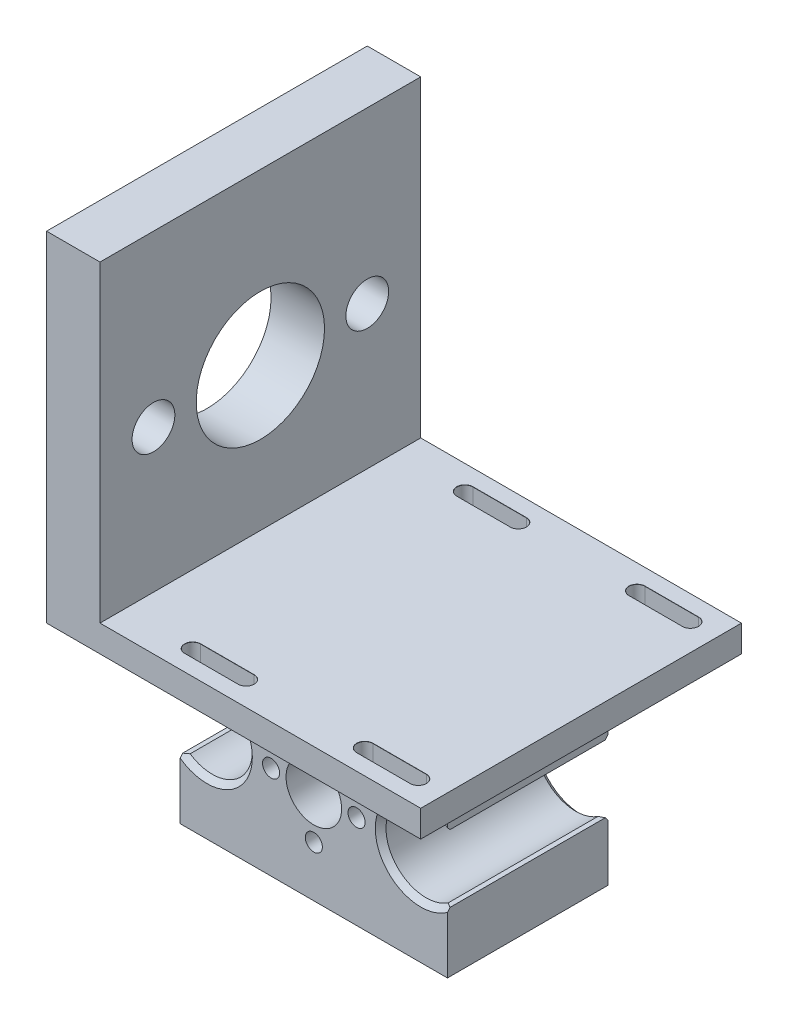
from build123d import *

# Parameters (mm, degrees)
SKETCH_1_W               = 50
SKETCH_1_H               = 35
EXTRUDE_1_DEPTH          = 30
HOLE_WIZARD_363_D        = 8.5
HOLE_WIZARD_468_D        = 3.2
HOLE_WIZARD_622_D        = 15
CHAMFER_1_SIZE           = 1
CHAMFER_1_SIZE_2         = 0.708203932
SKETCH_8_W               = 70
SKETCH_8_H               = 60
SKETCH_8_W_2             = 50
SKETCH_8_H_2             = 30
EXTRUDE_2_DEPTH          = 63.5
HOLE_WIZARD_1_D          = 24
HOLE_WIZARD_2_D          = 8
CHAMFER_2_SIZE           = 0.25
CUT_EXTRUDE_2_DEPTH      = 107.705201373
CUT_EXTRUDE_2_DEPTH_BACK = 107.705201373
SKETCH_14_W              = 60
SKETCH_14_H              = 58.5
MM_START                 = 17
MM_2_DEPTH               = 5.5
RIB_1_REACH              = 95.199
SKETCH_25_WALL_W         = 201.46144539
SKETCH_25_WALL_H         = 30
RIB_2_REACH              = 101.05
SKETCH_26_WALL_W         = 216.17250262
SKETCH_26_WALL_H         = 15
RIB_4_REACH              = 108.5
SKETCH_27_WALL_W         = 231.071518272
SKETCH_27_WALL_H         = 7
HOLE_WIZARD_3_D          = 10.4
HOLE_WIZARD_3_DEPTH      = 11


with BuildPart() as part:
    # 草图1 → 凸台-拉伸1 (new body)
    with BuildSketch(Plane.XY):
        Rectangle(SKETCH_1_W, SKETCH_1_H)
    extrude(amount=EXTRUDE_1_DEPTH)

    # Hole Wizard 363 (through all)
    with Locations(Plane.XY.offset(30)):
        with Locations((0, 0)):
            Hole(HOLE_WIZARD_363_D / 2)

    # Hole Wizard 468 (through all)
    with Locations(Plane.XY.offset(30)):
        with Locations((8, 0), (0, 8), (-8, 0), (0, -8)):
            Hole(HOLE_WIZARD_468_D / 2)

    # Hole Wizard 622 (through all)
    with Locations(Plane.XY.offset(30)):
        with Locations((20, 0), (-20, 0)):
            Hole(HOLE_WIZARD_622_D / 2)

    # 倒角1
    # the kernel refuses this chamfer: 1, 0.708203932 mm, written as the material it takes off along each edge
    with BuildSketch(Plane(origin=(-20, 0, 0), x_dir=(-0.8790200859122482, 0.4767847402789059, 0), z_dir=(-0.4767847402789059, -0.8790200859122482, 0))) as chamfer_1_piece_1:
        Polygon((7.5, -CHAMFER_1_SIZE), (7.5 + CHAMFER_1_SIZE, 0), (7.5, 0), align=None)
    revolve(axis=Axis((-20, 0, 0), (0, 0, -1)), revolution_arc=303.048763938, mode=Mode.SUBTRACT)
    with BuildSketch(Plane(origin=(-20, 0, 30), x_dir=(-0.879020085912248, 0.47678474027890627, 0), z_dir=(-0.47678474027890627, -0.879020085912248, 0))) as chamfer_1_piece_2:
        Polygon((7.5 + CHAMFER_1_SIZE, 0), (7.5, CHAMFER_1_SIZE), (7.5, 0), align=None)
    revolve(axis=Axis((-20, 0, 30), (0, 0, -1)), revolution_arc=303.048763938, mode=Mode.SUBTRACT)
    with BuildSketch(Plane(origin=(20, 0, 30), x_dir=(0.879020085912248, -0.4767847402789061, 0), z_dir=(0.4767847402789061, 0.879020085912248, 0))) as chamfer_1_piece_3:
        Polygon((7.5 + CHAMFER_1_SIZE, 0), (7.5, CHAMFER_1_SIZE), (7.5, 0), align=None)
    revolve(axis=Axis((20, 0, 30), (0, 0, -1)), revolution_arc=303.048763938, mode=Mode.SUBTRACT)
    with BuildSketch(Plane(origin=(20, 0, 0), x_dir=(0.8790200859122481, 0.476784740278906, 0), z_dir=(0.476784740278906, -0.8790200859122481, 0))) as chamfer_1_piece_4:
        Polygon((7.5, CHAMFER_1_SIZE), (7.5 + CHAMFER_1_SIZE, 0), (7.5, 0), align=None)
    revolve(axis=Axis((20, 0, 0), (0, 0, 1)), revolution_arc=303.048763938, mode=Mode.SUBTRACT)
    with BuildSketch(Plane(origin=(-25, 5.590169944, 32.778051389), x_dir=(0.7914486393779661, 0.611235675682274, 0), z_dir=(0, 0, -1)), Plane(origin=(25, -5.590169944, 32.778051389), x_dir=(-0.7914486393779661, -0.611235675682274, 0), z_dir=(0, 0, -1))) as chamfer_1_piece_5:
        with BuildLine():
            Line((1.080663788, 0), (CHAMFER_1_SIZE_2 * 0.611235676113, -CHAMFER_1_SIZE_2 * 0.791448639936))
            Line((CHAMFER_1_SIZE_2 * 0.611235676113, -CHAMFER_1_SIZE_2 * 0.791448639936), (0, 0))
            ThreePointArc((0, 0), (0.555522087, -0.019473843), (1.080663788, 0))
        make_face()
    extrude(amount=35.556102778, mode=Mode.SUBTRACT)
    with BuildSketch(Plane(origin=(-25, -5.590169944, 32.778051389), x_dir=(0.7914486393779665, -0.6112356756822735, 0), z_dir=(0, 0, -1))) as chamfer_1_piece_6:
        with BuildLine():
            Line((1.080663788, 0), (CHAMFER_1_SIZE_2 * 0.611235676113, CHAMFER_1_SIZE_2 * 0.791448639936))
            Line((CHAMFER_1_SIZE_2 * 0.611235676113, CHAMFER_1_SIZE_2 * 0.791448639936), (0, 0))
            ThreePointArc((0, 0), (0.555522087, 0.019473843), (1.080663788, 0))
        make_face()
    extrude(amount=35.556102778, mode=Mode.SUBTRACT)
    with BuildSketch(Plane(origin=(25, 5.590169944, 32.778051389), x_dir=(0, 1, 0), z_dir=(0, 0, -1))) as chamfer_1_piece_7:
        with BuildLine():
            Line((CHAMFER_1_SIZE_2, 0), (0.660540261, -0.855289885))
            ThreePointArc((0.660540261, -0.855289885), (0.354967464, -0.427764092), (0, 0))
            Line((0, 0), (CHAMFER_1_SIZE_2, 0))
        make_face()
    extrude(amount=35.556102778, mode=Mode.SUBTRACT)

    # 草图8 → 凸台-拉伸2 (add)
    # profile 1 of 5: a face of its own
    with BuildSketch(Plane(origin=(0, 17.5, 0), x_dir=(1, 0, 0), z_dir=(0, 1, 0))):
        with Locations((0, -15)):
            Rectangle(SKETCH_8_W, SKETCH_8_H)
        with Locations((0, -15)):
            Rectangle(SKETCH_8_W_2, SKETCH_8_H_2, mode=Mode.SUBTRACT)
    # profile 2 of 5: a face of its own
    with BuildSketch(Plane(origin=(0, 17.5, 0), x_dir=(1, 0, 0), z_dir=(0, 1, 0))):
        Polygon((25, 0), (0, -15), (25, -30), align=None)
    # profile 3 of 5: a face of its own
    with BuildSketch(Plane(origin=(0, 17.5, 0), x_dir=(1, 0, 0), z_dir=(0, 1, 0))):
        Polygon((25, -30), (0, -15), (-25, -30), align=None)
    # profile 4 of 5: a face of its own
    with BuildSketch(Plane(origin=(0, 17.5, 0), x_dir=(1, 0, 0), z_dir=(0, 1, 0))):
        Polygon((0, -15), (-25, 0), (-25, -30), align=None)
    # profile 5 of 5: a face of its own
    with BuildSketch(Plane(origin=(0, 17.5, 0), x_dir=(1, 0, 0), z_dir=(0, 1, 0))):
        Polygon((25, 0), (-25, 0), (0, -15), align=None)
    extrude(amount=EXTRUDE_2_DEPTH)

    # 孔1 (through all)
    with Locations(Plane(origin=(35, 0, 0), x_dir=(0, 0, -1), z_dir=(1, 0, 0))):
        with Locations((-15, 49.25)):
            Hole(HOLE_WIZARD_1_D / 2)

    # 孔2 (through all)
    with Locations(Plane(origin=(35, 0, 0), x_dir=(0, 0, -1), z_dir=(1, 0, 0))):
        with Locations((5, 49.25), (-35, 49.25)):
            Hole(HOLE_WIZARD_2_D / 2)

    # 倒角2
    chamfer_2_edges = [part.edges().sort_by_distance(p)[0] for p in [
        (-35, 49.25, 31),
        (-35, 49.25, -9),
    ]]
    chamfer(chamfer_2_edges, length=CHAMFER_2_SIZE)

    # 草图14 → 切除-拉伸2 (cut, two sides: drawn at the far end of the back side and taken through both)
    with BuildSketch(Plane.XY.offset(45).offset(-CUT_EXTRUDE_2_DEPTH_BACK)):
        with Locations((5, 51.75)):
            Rectangle(SKETCH_14_W, SKETCH_14_H)
    extrude(amount=CUT_EXTRUDE_2_DEPTH + CUT_EXTRUDE_2_DEPTH_BACK, mode=Mode.SUBTRACT)

    # 大小mm 暗销槽口2: read off the stored shape, not the designer's step
    # 大小mm 暗销槽口2 outline → 大小mm 暗销槽口2 (cut)
    with BuildSketch(Plane(origin=(0, 0, 0), x_dir=(1, 0, 0), z_dir=(0, 1, 0)).offset(MM_START)):
        with BuildLine():
            Line((30, 11.959259259), (20, 11.959259259))
            ThreePointArc((20, 11.959259259), (18.5, 10.459259259), (20, 8.959259259))
            Line((20, 8.959259259), (30, 8.959259259))
            ThreePointArc((30, 8.959259259), (31.5, 10.459259259), (30, 11.959259259))
        make_face()
        with BuildLine():
            ThreePointArc((-12.203065134, 11.959259259), (-13.703065134, 10.459259259), (-12.203065134, 8.959259259))
            Line((-12.203065134, 8.959259259), (-2.203065134, 8.959259259))
            ThreePointArc((-2.203065134, 8.959259259), (-0.703065134, 10.459259259), (-2.203065134, 11.959259259))
            Line((-2.203065134, 11.959259259), (-12.203065134, 11.959259259))
        make_face()
    mm_2 = extrude(amount=MM_2_DEPTH, mode=Mode.SUBTRACT)

    # mm _2 2: loft between two sections, ruled curve by curve
    mm_2_2_from = [
        Edge.make_three_point_arc((30, 22.475, -8.959259259), (31.060660172, 22.475, -9.398599087), (31.5, 22.475, -10.459259259)),
        Edge.make_three_point_arc((31.5, 22.475, -10.459259259), (31.060660172, 22.475, -11.519919431), (30, 22.475, -11.959259259)),
        Edge.make_three_point_arc((20, 22.475, -11.959259259), (18.939339828, 22.475, -11.519919431), (18.5, 22.475, -10.459259259)),
        Edge.make_three_point_arc((18.5, 22.475, -10.459259259), (18.939339828, 22.475, -9.398599087), (20, 22.475, -8.959259259)),
        Edge.make_line((30, 22.475, -11.959259259), (20, 22.475, -11.959259259)),
        Edge.make_line((30, 22.475, -8.959259259), (20, 22.475, -8.959259259)),
    ]
    mm_2_2_to = [
        Edge.make_three_point_arc((30, 22.5, -8.934259259), (31.078337841, 22.5, -9.380921418), (31.525, 22.5, -10.459259259)),
        Edge.make_three_point_arc((31.525, 22.5, -10.459259259), (31.078337841, 22.5, -11.537597101), (30, 22.5, -11.984259259)),
        Edge.make_three_point_arc((20, 22.5, -11.984259259), (18.921662159, 22.5, -11.537597101), (18.475, 22.5, -10.459259259)),
        Edge.make_three_point_arc((18.475, 22.5, -10.459259259), (18.921662159, 22.5, -9.380921418), (20, 22.5, -8.934259259)),
        Edge.make_line((30, 22.5, -11.984259259), (20, 22.5, -11.984259259)),
        Edge.make_line((30, 22.5, -8.934259259), (20, 22.5, -8.934259259)),
    ]
    mm_2_2 = Solid(Shell([*[Face.make_surface_from_curves(mm_2_2_from[k], mm_2_2_to[k]) for k in range(6)], Face(Wire(mm_2_2_from)), Face(Wire(mm_2_2_to))]))
    add(mm_2_2, mode=Mode.SUBTRACT)

    # mm _2 3: loft between two sections, ruled curve by curve
    mm_2_3_from = [
        Edge.make_three_point_arc((-2.203065134, 22.475, -8.959259259), (-1.142404962, 22.475, -9.398599087), (-0.703065134, 22.475, -10.459259259)),
        Edge.make_three_point_arc((-0.703065134, 22.475, -10.459259259), (-1.142404962, 22.475, -11.519919431), (-2.203065134, 22.475, -11.959259259)),
        Edge.make_three_point_arc((-12.203065134, 22.475, -11.959259259), (-13.263725306, 22.475, -11.519919431), (-13.703065134, 22.475, -10.459259259)),
        Edge.make_three_point_arc((-13.703065134, 22.475, -10.459259259), (-13.263725306, 22.475, -9.398599087), (-12.203065134, 22.475, -8.959259259)),
        Edge.make_line((-2.203065134, 22.475, -11.959259259), (-12.203065134, 22.475, -11.959259259)),
        Edge.make_line((-2.203065134, 22.475, -8.959259259), (-12.203065134, 22.475, -8.959259259)),
    ]
    mm_2_3_to = [
        Edge.make_three_point_arc((-2.203065134, 22.5, -8.934259259), (-1.124727293, 22.5, -9.380921418), (-0.678065134, 22.5, -10.459259259)),
        Edge.make_three_point_arc((-0.678065134, 22.5, -10.459259259), (-1.124727293, 22.5, -11.537597101), (-2.203065134, 22.5, -11.984259259)),
        Edge.make_three_point_arc((-12.203065134, 22.5, -11.984259259), (-13.281402975, 22.5, -11.537597101), (-13.728065134, 22.5, -10.459259259)),
        Edge.make_three_point_arc((-13.728065134, 22.5, -10.459259259), (-13.281402975, 22.5, -9.380921418), (-12.203065134, 22.5, -8.934259259)),
        Edge.make_line((-2.203065134, 22.5, -11.984259259), (-12.203065134, 22.5, -11.984259259)),
        Edge.make_line((-2.203065134, 22.5, -8.934259259), (-12.203065134, 22.5, -8.934259259)),
    ]
    mm_2_3 = Solid(Shell([*[Face.make_surface_from_curves(mm_2_3_from[k], mm_2_3_to[k]) for k in range(6)], Face(Wire(mm_2_3_from)), Face(Wire(mm_2_3_to))]))
    add(mm_2_3, mode=Mode.SUBTRACT)

    # 镜向1: 大小mm 暗销槽口2, mm _2 2, mm _2 3 across plane
    add(mm_2.mirror(Plane(origin=(0, 0, 15), x_dir=(1, 0, 0), z_dir=(0, 0, -1))), mode=Mode.SUBTRACT)
    add(mm_2_2.mirror(Plane(origin=(0, 0, 15), x_dir=(1, 0, 0), z_dir=(0, 0, -1))), mode=Mode.SUBTRACT)
    add(mm_2_3.mirror(Plane(origin=(0, 0, 15), x_dir=(1, 0, 0), z_dir=(0, 0, -1))), mode=Mode.SUBTRACT)

    # 草图25 wall → 筋1 (add, up to next)
    with BuildSketch(Plane(origin=(-30, 13.296768148, 15), x_dir=(-0.765461137236, 0.6434821267, 0), z_dir=(0.6434821267, 0.765461137236, 0)), mode=Mode.PRIVATE) as rib_1_sk1:
        Rectangle(SKETCH_25_WALL_W, SKETCH_25_WALL_H)
    rib_1_tool1 = extrude(rib_1_sk1.sketch, amount=RIB_1_REACH, mode=Mode.PRIVATE) - part.part
    rib_1 = rib_1_tool1.solids().sort_by_distance((-30, 13.296768148, 15))[0]
    add(rib_1)

    # 镜向2: 筋1 across plane
    add(rib_1.mirror(Plane(origin=(0, 0, 0), x_dir=(0, 0, 1), z_dir=(1, 0, 0))))

    # 草图26 wall → 筋2 (add, up to next)
    with BuildSketch(Plane(origin=(0, 14.614965359, 37.5), x_dir=(0, 0.359024529342, 0.933328124151), z_dir=(0, -0.933328124151, 0.359024529342)), mode=Mode.PRIVATE) as rib_2_sk1:
        with Locations((0, -7.5)):
            Rectangle(SKETCH_26_WALL_W, SKETCH_26_WALL_H)
    rib_2_tool1 = extrude(rib_2_sk1.sketch, amount=-RIB_2_REACH, mode=Mode.PRIVATE) - part.part
    rib_2 = rib_2_tool1.solids().sort_by_distance((0, 14.614965359, 37.5))[0]
    add(rib_2)

    # 草图27 wall → 筋4 (add, up to next)
    with BuildSketch(Plane(origin=(-17.5, 14.614965359, 37.5), x_dir=(0, -0.359024529342, -0.933328124151), z_dir=(0, 0.933328124151, -0.359024529342)), mode=Mode.PRIVATE) as rib_4_sk1:
        with Locations((0, 3.5)):
            Rectangle(SKETCH_27_WALL_W, SKETCH_27_WALL_H)
    rib_4_tool1 = extrude(rib_4_sk1.sketch, amount=RIB_4_REACH, mode=Mode.PRIVATE) - part.part
    rib_4 = rib_4_tool1.solids().sort_by_distance((-17.5, 14.614965359, 37.5))[0]
    add(rib_4)

    # 镜向4: 筋2, 筋4 across plane
    add(rib_2.mirror(Plane(origin=(0, 0, 15), x_dir=(1, 0, 0), z_dir=(0, 0, -1))))
    add(rib_4.mirror(Plane(origin=(0, 0, 15), x_dir=(1, 0, 0), z_dir=(0, 0, -1))))

    # 孔3
    with Locations(Plane.XY.offset(30)):
        with Locations((0, 0)):
            Hole(HOLE_WIZARD_3_D / 2, depth=HOLE_WIZARD_3_DEPTH)


solid = part.part
